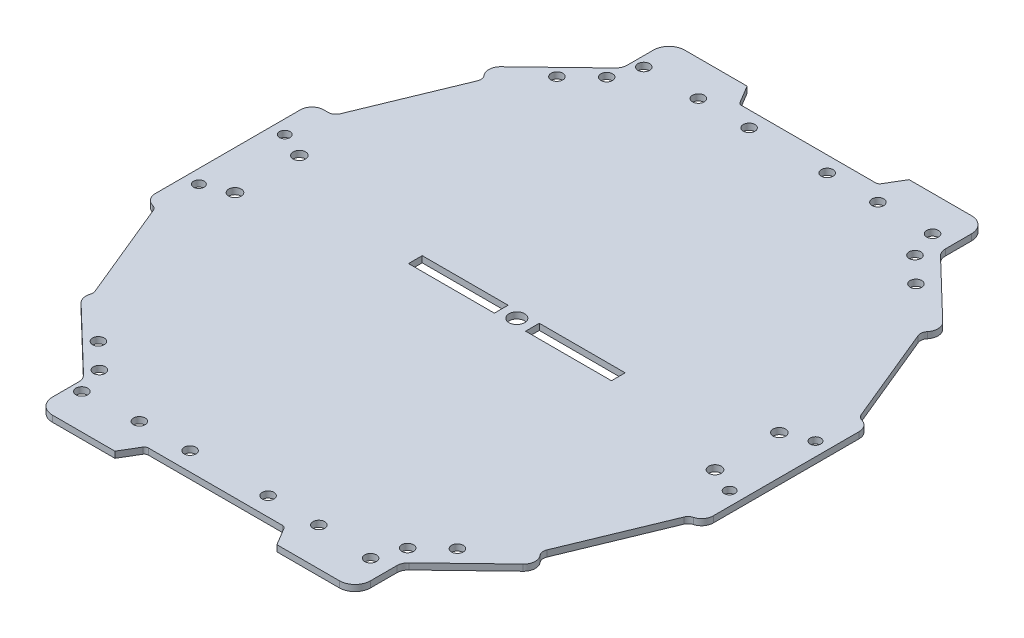
from build123d import *

# Parameters (mm, degrees)
SKETCH1_R        = 1.5
SKETCH1_R_2      = 1.6
SKETCH1_R_3      = 2
SKETCH1_R_4      = 1.35
SKETCH1_W        = 22
SKETCH1_H        = 3.516266508
EXTRUSION1_DEPTH = 1.6
FILLET1_R        = 1
FILLET2_R        = 4
FILLET3_R        = 3
FILLET4_R        = 3
FILLET5_R        = 2
FILLET6_R        = 2
FILLET7_R        = 3
FILLET8_R        = 3
FILLET9_R        = 2
FILLET10_R       = 2
FILLET11_R       = 3


with BuildPart() as part:
    # Sketch1 → Extrusion1 (new body)
    with BuildSketch(Plane(origin=(0, 0, 0), x_dir=(-1, 0, 0), z_dir=(0, 1, 0))):
        Polygon((59.775158519, 259.059874387), (56.775158519, 264.05987395), (36.775158519, 264.05987395), (36.775158519, 252.05987395), (18.755330752, 234.731117294), (21.527931817, 231.847944851), (10.275158581, 204.559863083), (7.275158519, 204.559863083), (7.275158519, 183.059873956), (7.275158519, 161.559884829), (10.275158581, 161.559884829), (21.527931817, 134.27180306), (18.755330752, 131.388630617), (36.775158519, 114.059873961), (36.775158519, 102.059873961), (56.775158519, 102.059873961), (59.775158519, 107.059873524), (76.297476624, 107.059873524), (95.297476624, 107.059873524), (98.297476624, 102.059873961), (118.297476624, 102.059873961), (118.297476624, 114.059873961), (136.317304391, 131.388630617), (133.544703326, 134.27180306), (144.797476562, 161.559884829), (150.275158519, 161.559884829), (150.275158519, 183.059873956), (150.275158519, 204.559863083), (147.275158457, 204.559863083), (136.022385221, 231.847944851), (137.604565953, 233.493222978), (118.297476624, 252.05987395), (118.297476624, 264.05987395), (98.297476624, 264.05987395), (95.297476624, 259.059874387), (76.297476624, 259.059874387), align=None)
        with Locations(Location((55.775158457, 111.059872631, 0), (0, 0, 90))):
            Circle(SKETCH1_R, mode=Mode.SUBTRACT)
        with Locations(Location((39.275158457, 118.059884829, 0), (0, 0, 90))):
            Circle(SKETCH1_R, mode=Mode.SUBTRACT)
        with Locations(Location((17.275158457, 174.809872631, 0), (0, 0, 90))):
            Circle(SKETCH1_R_2, mode=Mode.SUBTRACT)
        with Locations(Location((76.297476624, 183.059873956, 0), (0, 0, 90))):
            Circle(SKETCH1_R_3, mode=Mode.SUBTRACT)
        with Locations(Location((41.775158457, 255.059863083, 0), (0, 0, 90))):
            Circle(SKETCH1_R, mode=Mode.SUBTRACT)
        with Locations(Location((39.275158457, 248.059863083, 0), (0, 0, 90))):
            Circle(SKETCH1_R, mode=Mode.SUBTRACT)
        with Locations(Location((10.775158457, 194.05987528, 0), (0, 0, 90))):
            Circle(SKETCH1_R_4, mode=Mode.SUBTRACT)
        with Locations(Location((88.775158581, 111.059872631, 0), (0, 0, 90))):
            Circle(SKETCH1_R, mode=Mode.SUBTRACT)
        with Locations(Location((115.775158581, 111.059884829, 0), (0, 0, 90))):
            Circle(SKETCH1_R, mode=Mode.SUBTRACT)
        with Locations(Location((118.275158581, 118.059884829, 0), (0, 0, 90))):
            Circle(SKETCH1_R, mode=Mode.SUBTRACT)
        with Locations(Location((140.275158581, 174.809872631, 0), (0, 0, 90))):
            Circle(SKETCH1_R_2, mode=Mode.SUBTRACT)
        with Locations(Location((115.775158581, 255.059863083, 0), (0, 0, 90))):
            Circle(SKETCH1_R, mode=Mode.SUBTRACT)
        with Locations(Location((88.775158581, 254.309863083, 0), (0, 0, 90))):
            Circle(SKETCH1_R, mode=Mode.SUBTRACT)
        with Locations(Location((140.275158581, 191.30987528, 0), (0, 0, 90))):
            Circle(SKETCH1_R_2, mode=Mode.SUBTRACT)
        with Locations(Location((146.775158581, 194.05987528, 0), (0, 0, 90))):
            Circle(SKETCH1_R_4, mode=Mode.SUBTRACT)
        with Locations(Location((101.775158581, 254.309863083, 0), (0, 0, 90))):
            Circle(SKETCH1_R, mode=Mode.SUBTRACT)
        with Locations(Location((118.275158581, 248.059863083, 0), (0, 0, 90))):
            Circle(SKETCH1_R, mode=Mode.SUBTRACT)
        with Locations(Location((146.775158581, 172.059872631, 0), (0, 0, 90))):
            Circle(SKETCH1_R_4, mode=Mode.SUBTRACT)
        with Locations(Location((101.775158581, 111.059872631, 0), (0, 0, 90))):
            Circle(SKETCH1_R, mode=Mode.SUBTRACT)
        with Locations(Location((17.275158457, 191.30987528, 0), (0, 0, 90))):
            Circle(SKETCH1_R_2, mode=Mode.SUBTRACT)
        with Locations(Location((55.775158457, 254.309863083, 0), (0, 0, 90))):
            Circle(SKETCH1_R, mode=Mode.SUBTRACT)
        with Locations(Location((68.775158457, 254.309863083, 0), (0, 0, 90))):
            Circle(SKETCH1_R, mode=Mode.SUBTRACT)
        with Locations(Location((10.775158457, 172.059872631, 0), (0, 0, 90))):
            Circle(SKETCH1_R_4, mode=Mode.SUBTRACT)
        with Locations(Location((68.775158457, 111.059872631, 0), (0, 0, 90))):
            Circle(SKETCH1_R, mode=Mode.SUBTRACT)
        with Locations(Location((41.775158457, 111.059884829, 0), (0, 0, 90))):
            Circle(SKETCH1_R, mode=Mode.SUBTRACT)
        with Locations(Location((32.775158457, 124.309884829, 0), (0, 0, 90))):
            Circle(SKETCH1_R, mode=Mode.SUBTRACT)
        with Locations(Location((124.775158581, 241.809863083, 0), (0, 0, 90))):
            Circle(SKETCH1_R, mode=Mode.SUBTRACT)
        with Locations(Location((32.775158457, 241.809863083, 0), (0, 0, 90))):
            Circle(SKETCH1_R, mode=Mode.SUBTRACT)
        with Locations(Location((124.775158581, 124.309884829, 0), (0, 0, 90))):
            Circle(SKETCH1_R, mode=Mode.SUBTRACT)
        with Locations((61.297476624, 183.059873956)):
            Rectangle(SKETCH1_W, SKETCH1_H, mode=Mode.SUBTRACT)
        with Locations((91.297476624, 183.059873956)):
            Rectangle(SKETCH1_W, SKETCH1_H, mode=Mode.SUBTRACT)
    extrude(amount=EXTRUSION1_DEPTH)

    # Fillet1
    fillet1_edges = [part.edges().sort_by_distance(p)[0] for p in [
        (-95.297476624, 0.8, 259.059874387),
        (-95.297476624, 0.8, 107.059873524),
        (-59.775158519, 0.8, 107.059873524),
        (-59.775158519, 0.8, 259.059874387),
    ]]
    fillet(fillet1_edges, radius=FILLET1_R)

    # Fillet2
    fillet2_edges = [part.edges().sort_by_distance(p)[0] for p in [
        (-118.297476624, 0.8, 264.05987395),
        (-118.297476624, 0.8, 102.059873961),
        (-36.775158519, 0.8, 102.059873961),
        (-36.775158519, 0.8, 264.05987395),
    ]]
    fillet(fillet2_edges, radius=FILLET2_R)

    # Fillet3
    fillet3_edges = [part.edges().sort_by_distance(p)[0] for p in [
        (-118.297476624, 0.8, 252.05987395),
        (-118.297476624, 0.8, 114.059873961),
        (-36.775158519, 0.8, 114.059873961),
        (-36.775158519, 0.8, 252.05987395),
    ]]
    fillet(fillet3_edges, radius=FILLET3_R)

    # Fillet4
    # the kernel refuses this fillet: 3 mm, written as the material it takes off along each edge
    with BuildSketch(Plane(origin=(-137.604565953, -7.282396937, 233.493222978), x_dir=(0.7207931106757886, 0, 0.6931502662499095), z_dir=(0, 1, 0))) as fillet4_piece_1:
        with BuildLine():
            CenterArc((2.912958775, 3), FILLET4_R, 193.835510016, 76.164489984)
            Line((0, 2.282594135), (-0.058259176, 2.268246017))
            ThreePointArc((-0.058259176, 2.268246017), (-0.06, 1.141297067), (-0.06, 0))
            Line((-0.06, 0), (0, -0.06))
            Line((0, -0.06), (2.912958775, -0.06))
            Line((2.912958775, -0.06), (2.912958775, 0))
        make_face()
    extrude(amount=16.164793875, mode=Mode.SUBTRACT)

    # Fillet5
    fillet5_edges = [part.edges().sort_by_distance(p)[0] for p in [
        (-136.022385221, 0.8, 231.847944851),
    ]]
    fillet(fillet5_edges, radius=FILLET5_R)

    # Fillet6
    fillet6_edges = [part.edges().sort_by_distance(p)[0] for p in [
        (-21.527931817, 0.8, 231.847944851),
    ]]
    fillet(fillet6_edges, radius=FILLET6_R)

    # Fillet7
    fillet7_edges = [part.edges().sort_by_distance(p)[0] for p in [
        (-18.755330752, 0.8, 234.731117294),
    ]]
    fillet(fillet7_edges, radius=FILLET7_R)

    # Fillet8
    fillet8_edges = [part.edges().sort_by_distance(p)[0] for p in [
        (-136.317304391, 0.8, 131.388630617),
        (-18.755330752, 0.8, 131.388630617),
    ]]
    fillet(fillet8_edges, radius=FILLET8_R)

    # Fillet9
    fillet9_edges = [part.edges().sort_by_distance(p)[0] for p in [
        (-21.527931817, 0.8, 134.27180306),
        (-133.544703326, 0.8, 134.27180306),
    ]]
    fillet(fillet9_edges, radius=FILLET9_R)

    # Fillet10
    fillet10_edges = [part.edges().sort_by_distance(p)[0] for p in [
        (-147.275158457, 0.8, 204.559863083),
        (-144.797476562, 0.8, 161.559884829),
        (-10.275158581, 0.8, 161.559884829),
        (-10.275158581, 0.8, 204.559863083),
    ]]
    fillet(fillet10_edges, radius=FILLET10_R)

    # Fillet11
    fillet11_edges = [part.edges().sort_by_distance(p)[0] for p in [
        (-150.275158519, 0.8, 161.559884829),
        (-150.275158519, 0.8, 204.559863083),
        (-7.275158519, 0.8, 204.559863083),
        (-7.275158519, 0.8, 161.559884829),
    ]]
    fillet(fillet11_edges, radius=FILLET11_R)


solid = part.part
